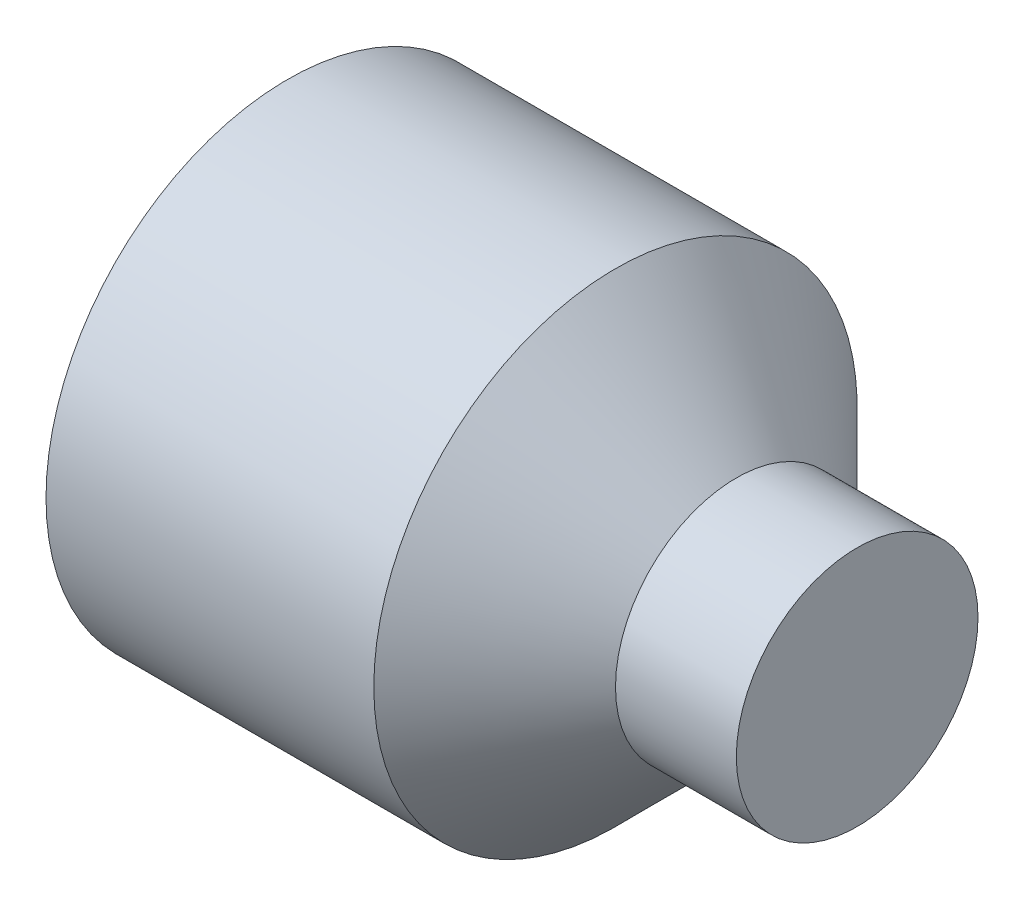
from build123d import *

# Parameters (mm, degrees)
HEXAGONSOCKET_DEPTH = 0.7


with BuildPart() as part:
    # BodySke → BaseBody (revolve)
    with BuildSketch(Plane.XY):
        Polygon((2, 0), (2, 0.4), (1.6, 0.4), (1.2, 0.8), (0, 0.8), (0, 0), align=None)
    revolve(axis=Axis((0, 0, 0), (1, 0, 0)))

    # HeadChamferSke → HeadChamfer (revolve, cut)
    with BuildSketch(Plane.XY):
        Polygon((0, 0.8), (0, 0.601), (0.114892704, 0.8), align=None)
    revolve(axis=Axis((0, 0, 0), (1, 0, 0)), mode=Mode.SUBTRACT)

    # HexagonSocketSke → HexagonSocket (cut)
    with BuildSketch(Plane.ZY):
        Polygon((0, 0.404145188), (-0.35, 0.202072594), (-0.35, -0.202072594), (0, -0.404145188), (0.35, -0.202072594), (0.35, 0.202072594), align=None)
    extrude(amount=-HEXAGONSOCKET_DEPTH, mode=Mode.SUBTRACT)


solid = part.part
